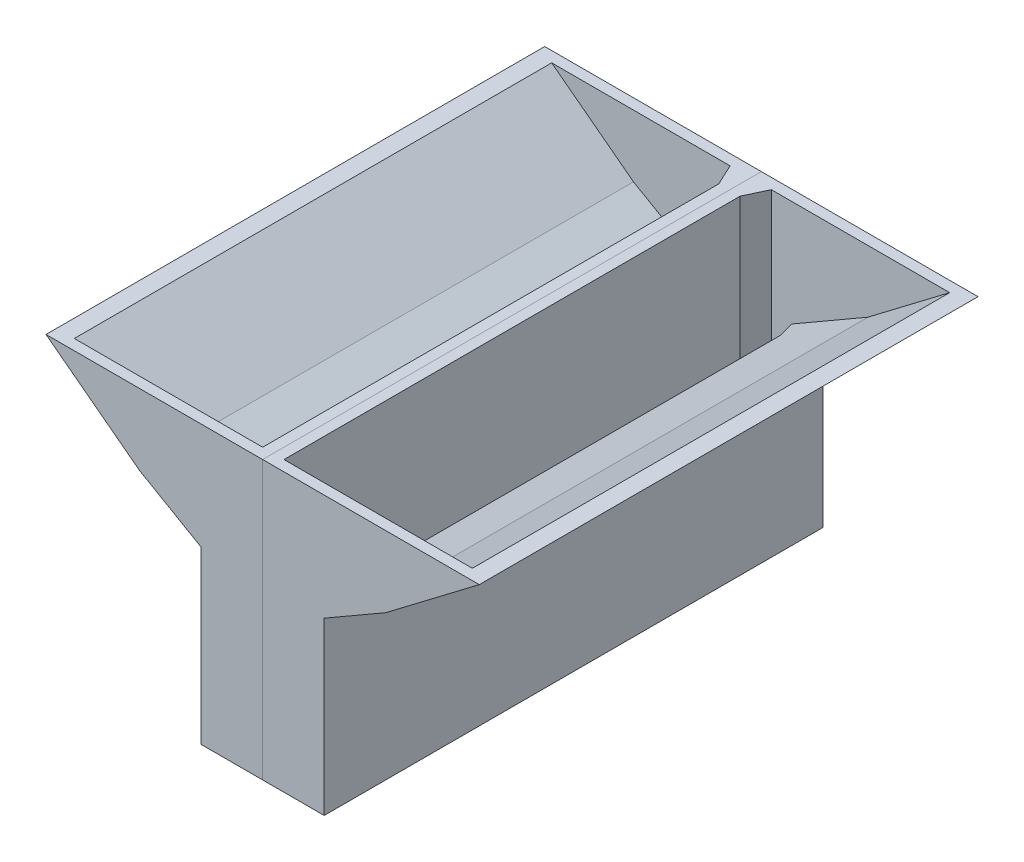
from build123d import *

# Parameters (mm, degrees)
BOSS_EXTRUDE1_DEPTH = 701.675
SHELL1_T            = -30
SKETCH3_W           = 113.205080757
SKETCH3_H           = 1343.35
CUT_EXTRUDE1_DEPTH  = 1146.801014847
SKETCH4_W           = 1403.35
SKETCH4_H           = 80.832113544
BOSS_EXTRUDE2_DEPTH = 173.20508
BOSS_EXTRUDE3_REACH = 1150.165
SKETCH10_W          = 60
SKETCH10_H          = 400
CUT_EXTRUDE5_DEPTH  = 30
CUT_EXTRUDE6_DEPTH  = 113.205081
SKETCH12_W          = 26.602540378
SKETCH12_H          = 50.832113544
SKETCH12_W_2        = 26.602540379
BOSS_EXTRUDE4_DEPTH = 30
CHAMFER3_SIZE       = 30
CHAMFER3_SIZE2      = 64.550235712
CHAMFER4_SIZE       = 27.978459489
CHAMFER4_SIZE_2     = 60
FILLET2_R           = 15


with BuildPart() as part:
    # Sketch2 → Boss-Extrude1 (new, symmetric)
    with BuildSketch(Plane.XY):
        Polygon((0, 0), (0, 700), (-609.6, 700), (-346.410161514, 500), (-173.205080757, 400), (-173.205080757, 0), align=None)
    extrude(amount=BOSS_EXTRUDE1_DEPTH, both=True)

    # Shell1
    shell1_openings = [part.faces().sort_by_distance(p)[0] for p in [
        (-304.8, 700, 0),
    ]]
    offset(amount=SHELL1_T, openings=shell1_openings, kind=Kind.INTERSECTION)

    # Sketch3 → Cut-Extrude1 (cut, through all)
    with BuildSketch(Plane(origin=(0, 30, 0), x_dir=(1, 0, 0), z_dir=(0, 1, 0))):
        with Locations((-86.602540379, 0)):
            Rectangle(SKETCH3_W, SKETCH3_H)
    extrude(amount=-CUT_EXTRUDE1_DEPTH, mode=Mode.SUBTRACT)

    # Sketch4 → Boss-Extrude2 (add)
    with BuildSketch(Plane(origin=(0, 0, 0), x_dir=(0, 0, -1), z_dir=(1, 0, 0))):
        with Locations((0, -40.416056772)):
            Rectangle(SKETCH4_W, SKETCH4_H)
    extrude(amount=-BOSS_EXTRUDE2_DEPTH)

    # Sketch8 → Boss-Extrude3 (add, up to next)
    with BuildSketch(Plane.ZY.offset(30), mode=Mode.PRIVATE) as boss_extrude3_sk1:
        Polygon((671.675, -50.832113544), (-701.675, -50.832113544), (671.675, 99.167886456), align=None)
    boss_extrude3_tool1 = extrude(boss_extrude3_sk1.sketch, amount=BOSS_EXTRUDE3_REACH, mode=Mode.PRIVATE) - part.part
    add(boss_extrude3_tool1.solids().sort_by_distance((-30, -0.832114, 213.891667))[0])

    # Sketch10 → Cut-Extrude5 (cut)
    with BuildSketch(Plane(origin=(0, 0, -701.675), x_dir=(-1, 0, 0), z_dir=(0, 0, -1))):
        with Locations((86.602540378, 119.167886456)):
            Rectangle(SKETCH10_W, SKETCH10_H)
    extrude(amount=-CUT_EXTRUDE5_DEPTH, mode=Mode.SUBTRACT)

    # Sketch11 → Cut-Extrude6 (cut)
    with BuildSketch(Plane.ZY.offset(30)):
        Polygon((-238.734415101, 0), (-701.675, 0), (-701.675, -50.832113544), align=None)
    extrude(amount=CUT_EXTRUDE6_DEPTH, mode=Mode.SUBTRACT)

    # Sketch12 → Boss-Extrude4 (add)
    with BuildSketch(Plane(origin=(0, 0, -701.675), x_dir=(-1, 0, 0), z_dir=(0, 0, -1))):
        with Locations((43.301270189, -25.416056772)):
            Rectangle(SKETCH12_W, SKETCH12_H)
        with Locations((129.903810568, -25.416056772)):
            Rectangle(SKETCH12_W_2, SKETCH12_H)
    extrude(amount=-BOSS_EXTRUDE4_DEPTH)

    # Chamfer3
    chamfer3_edges = [part.edges().sort_by_distance(p)[0] for p in [
        (-86.602540378, -47.538033361, -671.675),
    ]]
    chamfer3_side = [part.faces().sort_by_distance(p)[0] for p in [
        (-86.602540378, -64.185073453, -671.675),
    ]]
    chamfer(chamfer3_edges, length=CHAMFER3_SIZE, length2=CHAMFER3_SIZE2, reference=chamfer3_side[0])

    # Chamfer4
    # the kernel refuses this chamfer: 60, 27.978459489 mm, written as the material it adds along each edge
    with BuildSketch(Plane(origin=(-30, -202.996561647, -671.675), x_dir=(-0.9971975577536775, 0, -0.07481330637059934), z_dir=(0, 1, 0))) as chamfer4_piece_1_section:
        Polygon((CHAMFER4_SIZE * 0.997197557764, CHAMFER4_SIZE * 0.0748133063714), (-CHAMFER4_SIZE_2 * 0.0748133063706, CHAMFER4_SIZE_2 * 0.997197557754), (0, 0), align=None)
    chamfer4_piece_1 = extrude(amount=902.996561647, mode=Mode.PRIVATE)
    chamfer4_piece_1 = split(chamfer4_piece_1, bisect_by=Plane(origin=(-56.602540378, 136.912183194, -651.689026628), z_dir=(1, 0, 0)), keep=Keep.TOP, mode=Mode.PRIVATE)
    chamfer4_piece_1 = split(chamfer4_piece_1, bisect_by=Plane(origin=(-39.296991829, -43.172308533, -631.915268116), z_dir=(0, 0.9940256554090712, -0.1091466737402779)), keep=Keep.TOP, mode=Mode.PRIVATE)
    add(chamfer4_piece_1)
    with BuildSketch(Plane(origin=(-30, -202.996561647, -671.675), x_dir=(-0.9971975577536775, 0, -0.07481330637059934), z_dir=(0, 1, 0))) as chamfer4_piece_2_section:
        Polygon((CHAMFER4_SIZE * 0.997197557764, CHAMFER4_SIZE * 0.0748133063714), (-CHAMFER4_SIZE_2 * 0.0748133063706, CHAMFER4_SIZE_2 * 0.997197557754), (0, 0), align=None)
    chamfer4_piece_2 = extrude(amount=902.996561647, mode=Mode.PRIVATE)
    chamfer4_piece_2 = split(chamfer4_piece_2, bisect_by=Plane(origin=(-57.061180082, 319.167886456, -670.691443982), z_dir=(0, 1, 0)), keep=Keep.TOP, mode=Mode.PRIVATE)
    add(chamfer4_piece_2)
    with BuildSketch(Plane(origin=(-143.205080757, 572.779036361, -671.675), x_dir=(0.9971975577536775, 0, -0.07481330637059934), z_dir=(0, -1, 0))) as chamfer4_piece_3_section:
        Polygon((CHAMFER4_SIZE * 0.997197557764, CHAMFER4_SIZE * 0.0748133063714), (-CHAMFER4_SIZE_2 * 0.0748133063706, CHAMFER4_SIZE_2 * 0.997197557754), (0, 0), align=None)
    chamfer4_piece_3 = extrude(amount=572.779036361, mode=Mode.PRIVATE)
    chamfer4_piece_3 = split(chamfer4_piece_3, bisect_by=Plane(origin=(-116.144636453, 319.167886456, -670.690655041), z_dir=(0, 1, 0)), keep=Keep.TOP, mode=Mode.PRIVATE)
    chamfer4_piece_3 = split(chamfer4_piece_3, bisect_by=Plane(origin=(-98.276526048, 391.38099492, -670.690655041), z_dir=(-0.4999999999999916, -0.8660254037844436, 0)), keep=Keep.TOP, mode=Mode.PRIVATE)
    add(chamfer4_piece_3)
    with BuildSketch(Plane(origin=(-143.205080757, 572.779036361, -671.675), x_dir=(0.9971975577536775, 0, -0.07481330637059934), z_dir=(0, -1, 0))) as chamfer4_piece_4_section:
        Polygon((CHAMFER4_SIZE * 0.997197557764, CHAMFER4_SIZE * 0.0748133063714), (-CHAMFER4_SIZE_2 * 0.0748133063706, CHAMFER4_SIZE_2 * 0.997197557754), (0, 0), align=None)
    chamfer4_piece_4 = extrude(amount=572.779036361, mode=Mode.PRIVATE)
    chamfer4_piece_4 = split(chamfer4_piece_4, bisect_by=Plane(origin=(-116.602540378, 159.583943228, -651.628898069), z_dir=(-1, 0, 0)), keep=Keep.TOP, mode=Mode.PRIVATE)
    chamfer4_piece_4 = split(chamfer4_piece_4, bisect_by=Plane(origin=(-24.639506088, 348.866641624, -651.628898069), z_dir=(-0.4999999999999916, -0.8660254037844436, 0)), keep=Keep.TOP, mode=Mode.PRIVATE)
    add(chamfer4_piece_4)
    with BuildSketch(Plane(origin=(-143.205080757, 0, -671.675), x_dir=(0.997197557763733, 0, -0.07481330623656689), z_dir=(0, -1, 0))) as chamfer4_piece_5_section:
        Polygon((CHAMFER4_SIZE * 0.997197557774, CHAMFER4_SIZE * 0.0748133062374), (-CHAMFER4_SIZE_2 * 0.0748133102771, CHAMFER4_SIZE_2 * 0.997197557461), (0, 0), align=None)
    chamfer4_piece_5 = extrude(amount=202.996561649, mode=Mode.PRIVATE)
    chamfer4_piece_5 = split(chamfer4_piece_5, bisect_by=Plane(origin=(-133.810698644, -45.119634059, -649.650041571), z_dir=(0, 0.9940256554090712, -0.1091466737402779)), keep=Keep.TOP, mode=Mode.PRIVATE)
    chamfer4_piece_5 = split(chamfer4_piece_5, bisect_by=Plane(origin=(-116.602540378, -22.694999754, -652.112326353), z_dir=(-1, 0, 0)), keep=Keep.TOP, mode=Mode.PRIVATE)
    add(chamfer4_piece_5)

    # Fillet2
    # the kernel refuses this fillet: 15 mm, written as the material it takes off along each edge
    with BuildSketch(Plane(origin=(-116.602540378, -51.307042391, -706.000294048), x_dir=(-1, 0, 0), z_dir=(0, 0.1091466737402779, 0.9940256554090712))) as fillet2_piece_1_section:
        with BuildLine():
            CenterArc((FILLET2_R, FILLET2_R), FILLET2_R, 180, 90)
            Line((0, FILLET2_R), (0, 0))
            Line((0, 0), (FILLET2_R, 0))
        make_face()
    fillet2_piece_1 = extrude(amount=136.581833424, mode=Mode.PRIVATE)
    fillet2_piece_1 = split(fillet2_piece_1, bisect_by=Plane(origin=(-128.893894845, -47.070973497, -642.365437483), z_dir=(0.9063077856304061, 0, 0.4226182647563991)), keep=Keep.TOP, mode=Mode.PRIVATE)
    fillet2_piece_1 = split(fillet2_piece_1, bisect_by=Plane(origin=(-119.802580373, -55.394163315, -633.320692004), z_dir=(0, 0.8660254037844397, -0.4999999999999981)), keep=Keep.TOP, mode=Mode.PRIVATE)
    add(fillet2_piece_1, mode=Mode.SUBTRACT)
    with BuildSketch(Plane(origin=(-56.602540378, -51.307042388, -706.000294023), x_dir=(1, 0, 0), z_dir=(0, 0.1091466737402779, 0.9940256554090712))) as fillet2_piece_2_section:
        with BuildLine():
            CenterArc((FILLET2_R, -FILLET2_R), FILLET2_R, 90, 90)
            Line((0, -FILLET2_R), (0, 0))
            Line((0, 0), (FILLET2_R, 0))
        make_face()
    fillet2_piece_2 = extrude(amount=136.581833399, mode=Mode.PRIVATE)
    fillet2_piece_2 = split(fillet2_piece_2, bisect_by=Plane(origin=(-44.311185982, -47.070973496, -642.36543738), z_dir=(-0.9063077870369262, 0, 0.42261826174010714)), keep=Keep.TOP, mode=Mode.PRIVATE)
    fillet2_piece_2 = split(fillet2_piece_2, bisect_by=Plane(origin=(-53.402500388, -55.394163299, -633.320691976), z_dir=(0, 0.8660254037844397, -0.4999999999999981)), keep=Keep.TOP, mode=Mode.PRIVATE)
    add(fillet2_piece_2, mode=Mode.SUBTRACT)


with BuildPart() as body_2:
    # Mirror2: mirrored copy
    add(part.part.mirror(Plane(origin=(0, 0, 701.675), x_dir=(0, 0, 1), z_dir=(-1, 0, 0))))


solid = Compound([part.part, body_2.part])
